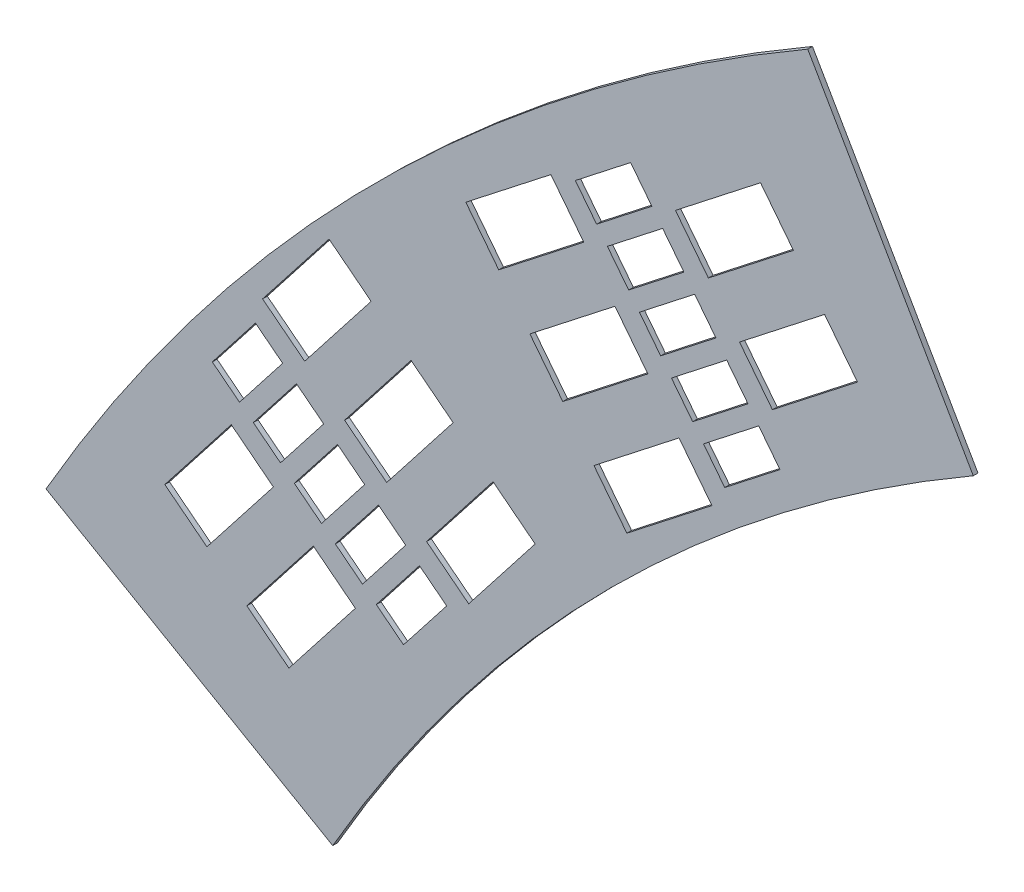
from build123d import *

# Parameters (mm, degrees)
BOSS_EXTRUDE1_DEPTH = 0.1
CUT_EXTRUDE1_DEPTH  = 108.77773425


with BuildPart() as part:
    # Sketch1 → Boss-Extrude1 (new, symmetric)
    with BuildSketch(Plane(origin=(0, 0, 0), x_dir=(0, 1, 0), z_dir=(0, 0, 1))):
        with BuildLine():
            Line((44, 76.210235533), (37, 64.08587988))
            ThreePointArc((37, 64.08587988), (52.325901808, 52.325901808), (64.08587988, 37))
            Line((64.08587988, 37), (76.210235533, 44))
            ThreePointArc((76.210235533, 44), (62.225396744, 62.225396744), (44, 76.210235533))
        make_face()
    extrude(amount=BOSS_EXTRUDE1_DEPTH, both=True)

    # Sketch2 → Cut-Extrude1 (cut, through all)
    with BuildSketch(Plane.XY.offset(0.1)):
        Polygon((-62.24359509, 46.748706682), (-60.418158816, 49.085158567), (-59.267663116, 48.186292813), (-61.09309939, 45.849840928), align=None)
        Polygon((-63.977218748, 48.103161928), (-62.151782474, 50.439613813), (-61.001286774, 49.540748059), (-62.826723048, 47.204296174), align=None)
        Polygon((-65.710842406, 49.457617174), (-63.885406132, 51.794069058), (-62.734910432, 50.895203304), (-64.560346706, 48.55875142), align=None)
        Polygon((-47.50906519, 58.400851287), (-45.172613306, 60.226287561), (-46.07147906, 61.376783261), (-48.407930944, 59.551346987), align=None)
        Polygon((-49.76238619, 61.284970645), (-47.425934305, 63.110406919), (-46.527068551, 61.959911219), (-48.863520436, 60.134474945), align=None)
        Polygon((-51.116841435, 63.018594303), (-48.780389551, 64.844030577), (-47.881523797, 63.693534877), (-50.217975681, 61.868098603), align=None)
        Polygon((-52.471296681, 64.752217961), (-50.134844797, 66.577654235), (-49.235979043, 65.427158535), (-51.572430927, 63.601722261), align=None)
        Polygon((-53.825751927, 66.485841619), (-51.489300042, 68.311277893), (-50.590434288, 67.160782193), (-52.926886173, 65.335345919), align=None)
        Polygon((-67.444466064, 50.81207242), (-65.61902979, 53.148524304), (-64.46853409, 52.24965855), (-66.293970364, 49.913206666), align=None)
        Polygon((-69.178089722, 52.166527665), (-67.352653448, 54.50297955), (-66.202157748, 53.604113796), (-68.027594022, 51.267661911), align=None)
        Polygon((-60.117701642, 50.119433911), (-57.307207007, 53.716703001), (-55.526302704, 52.325308067), (-58.336797339, 48.728038976), align=None)
        Polygon((-63.584948958, 52.828344402), (-60.774454323, 56.425613492), (-58.99355002, 55.034218558), (-61.804044655, 51.436949468), align=None)
        Polygon((-67.052196274, 55.537254893), (-64.241701639, 59.134523984), (-62.460797336, 57.743129049), (-65.271291971, 54.145859959), align=None)
        Polygon((-67.71857916, 43.964146674), (-64.908084525, 47.561415765), (-63.127180222, 46.17002083), (-65.937674857, 42.57275174), align=None)
        Polygon((-71.185826476, 46.673057166), (-68.375331841, 50.270326256), (-66.594427538, 48.878931322), (-69.404922173, 45.281662232), align=None)
        Polygon((-49.442206288, 59.250889813), (-53.039475378, 56.440395178), (-51.648080444, 54.659490875), (-48.050811353, 57.46998551), align=None)
        Polygon((-52.151116779, 62.718137129), (-55.748385869, 59.907642494), (-54.356990935, 58.126738191), (-50.759721845, 60.937232826), align=None)
        Polygon((-54.860027271, 66.185384445), (-58.457296361, 63.37488981), (-57.065901427, 61.593985507), (-53.468632336, 64.404480142), align=None)
        Polygon((-45.492793208, 62.260368393), (-41.895524117, 65.070863028), (-43.286919052, 66.851767331), (-46.884188142, 64.041272696), align=None)
        Polygon((-48.201703699, 65.727615709), (-44.604434609, 68.538110344), (-45.995829543, 70.319014647), (-49.593098633, 67.508520012), align=None)
    extrude(amount=-CUT_EXTRUDE1_DEPTH, mode=Mode.SUBTRACT)


solid = part.part
